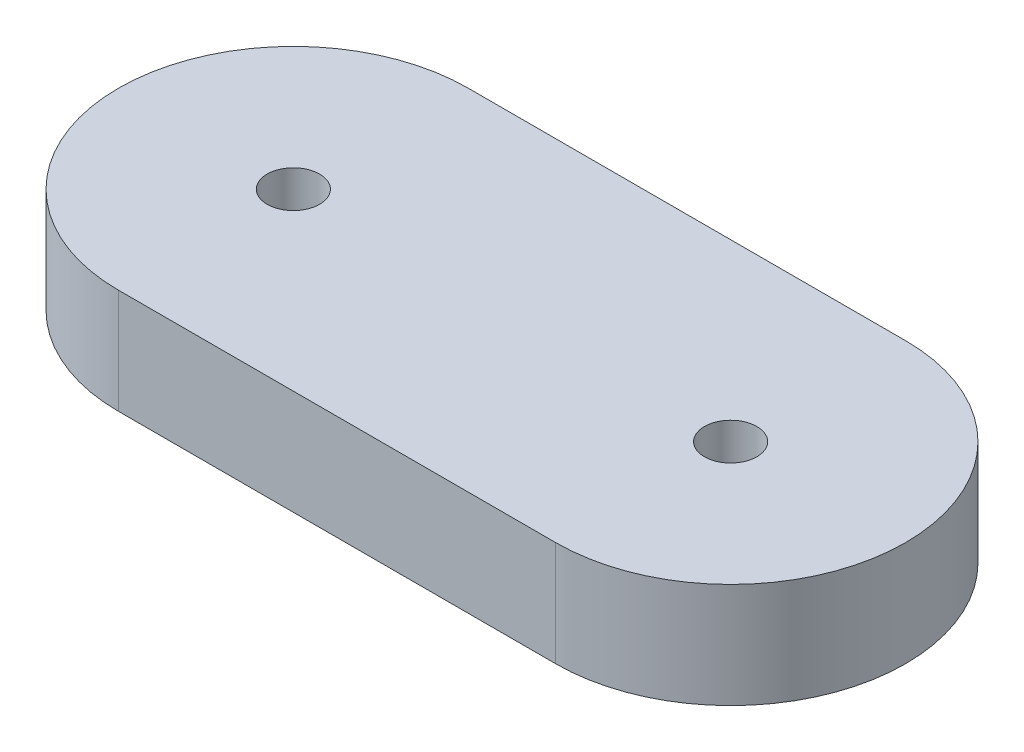
from build123d import *

# Parameters (mm, degrees)
SKETCH1_R           = 1.5
BOSS_EXTRUDE1_DEPTH = 6


with BuildPart() as part:
    # Sketch1 → Boss-Extrude1 (new body)
    with BuildSketch(Plane(origin=(0, 0, 0), x_dir=(1, 0, 0), z_dir=(0, 1, 0))):
        with BuildLine():
            Line((-12.5, 10), (0, 10))
            Line((0, 10), (0, -10))
            Line((0, -10), (-12.5, -10))
            ThreePointArc((-12.5, -10), (-22.5, 0), (-12.5, 10))
        make_face()
        with Locations((-12.5, 0)):
            Circle(SKETCH1_R, mode=Mode.SUBTRACT)
    boss_extrude1 = extrude(amount=BOSS_EXTRUDE1_DEPTH)

    # Mirror1: Boss-Extrude1 across plane
    add(boss_extrude1.mirror(Plane(origin=(0, 6, -10), x_dir=(0, 0, 1), z_dir=(-1, 0, 0))))


solid = part.part
